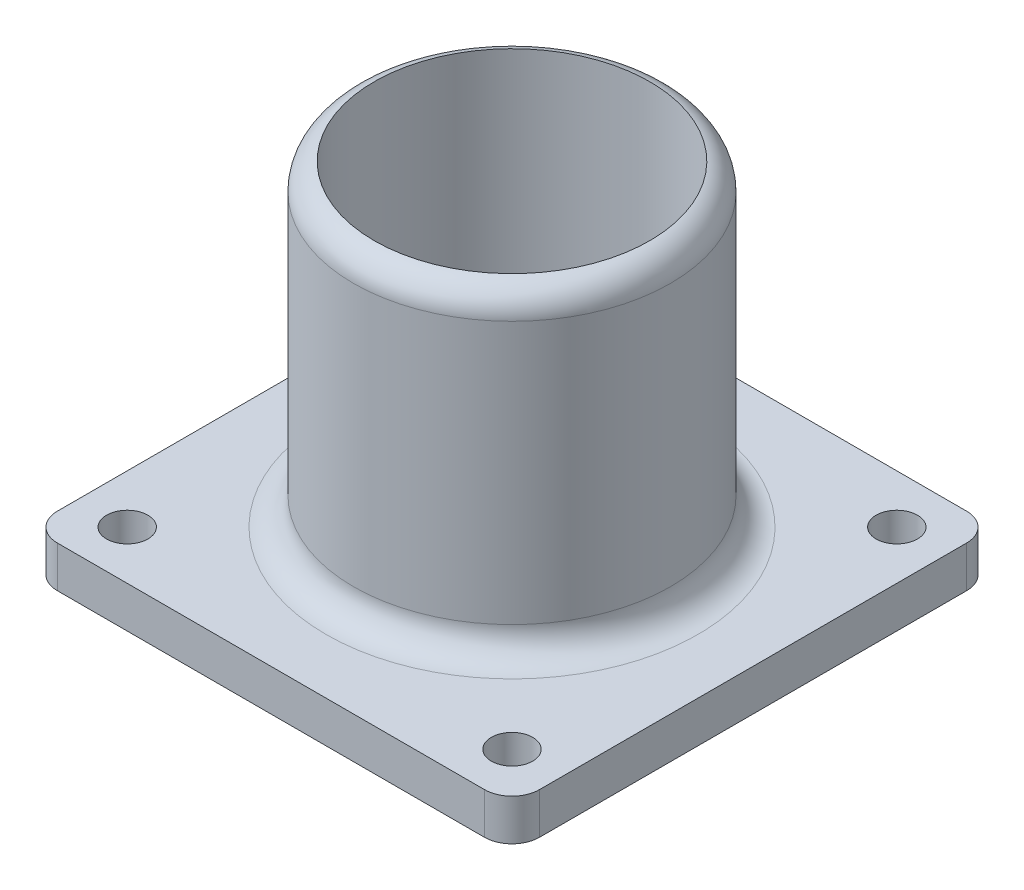
from build123d import *

# Parameters (mm, degrees)
ESBO_O1_W                = 35
ESBO_O1_H                = 35
ESBO_O1_R                = 10
ESBO_O1_R_2              = 1.5
RESSALTO_EXTRUS_O1_DEPTH = 1.5
FILETE1_R                = 2
ESBO_O2_R                = 11.5
ESBO_O2_R_2              = 10
RESSALTO_EXTRUS_O2_DEPTH = 23
FILETE2_R                = 2


with BuildPart() as part:
    # Esboço1 → Ressalto-extrusão1 (new, symmetric)
    with BuildSketch(Plane(origin=(0, 0, 0), x_dir=(1, 0, 0), z_dir=(0, 1, 0))):
        Rectangle(ESBO_O1_W, ESBO_O1_H)
        with Locations(Location((0, 0, 0), (0, 0, 270))):
            Circle(ESBO_O1_R, mode=Mode.SUBTRACT)
        with Locations(Location((-13.964466094, 13.964466094, 0), (0, 0, 270))):
            Circle(ESBO_O1_R_2, mode=Mode.SUBTRACT)
        with Locations(Location((13.964466094, 13.964466094, 0), (0, 0, 270))):
            Circle(ESBO_O1_R_2, mode=Mode.SUBTRACT)
        with Locations(Location((13.964466094, -13.964466094, 0), (0, 0, 270))):
            Circle(ESBO_O1_R_2, mode=Mode.SUBTRACT)
        with Locations(Location((-13.964466094, -13.964466094, 0), (0, 0, 270))):
            Circle(ESBO_O1_R_2, mode=Mode.SUBTRACT)
    extrude(amount=RESSALTO_EXTRUS_O1_DEPTH, both=True)

    # Filete1
    filete1_edges = [part.edges().sort_by_distance(p)[0] for p in [
        (17.5, 0, 17.5),
        (-17.5, 0, 17.5),
        (-17.5, 0, -17.5),
        (17.5, 0, -17.5),
    ]]
    fillet(filete1_edges, radius=FILETE1_R)

    # Esboço2 → Ressalto-extrusão2 (add)
    with BuildSketch(Plane(origin=(0, 1.5, 0), x_dir=(1, 0, 0), z_dir=(0, 1, 0))):
        with Locations(Location((0, 0, 0), (0, 0, 90))):
            Circle(ESBO_O2_R)
        with Locations(Location((0, 0, 0), (0, 0, 270))):
            Circle(ESBO_O2_R_2, mode=Mode.SUBTRACT)
    extrude(amount=RESSALTO_EXTRUS_O2_DEPTH)

    # Filete2
    # the kernel refuses this fillet: 2 mm, written as the material it adds along each edge
    with BuildSketch(Plane(origin=(0, 1.5, 0), x_dir=(0, 0, -1), z_dir=(1, 0, 0))) as filete2_piece_1:
        with BuildLine():
            CenterArc((11.5 + FILETE2_R, FILETE2_R), FILETE2_R, 180, 90)
            Line((11.5, FILETE2_R), (11.5, 0))
            Line((11.5, 0), (11.5 + FILETE2_R, 0))
        make_face()
    revolve(axis=Axis((0, 1.5, 0), (0, 1, 0)))
    # the kernel refuses this fillet: 2 mm, written as the material it takes off along each edge
    with BuildSketch(Plane(origin=(0, 24.5, 0), x_dir=(0, 0, -1), z_dir=(1, 0, 0))) as filete2_2_piece_1:
        with BuildLine():
            CenterArc((9.5, -1.936491673), FILETE2_R, 0, 75.522487814)
            Line((11.5, -1.936491673), (11.5, 0))
            Line((11.5, 0), (10, 0))
        make_face()
    revolve(axis=Axis((0, 24.5, 0), (0, 1, 0)), mode=Mode.SUBTRACT)


solid = part.part
